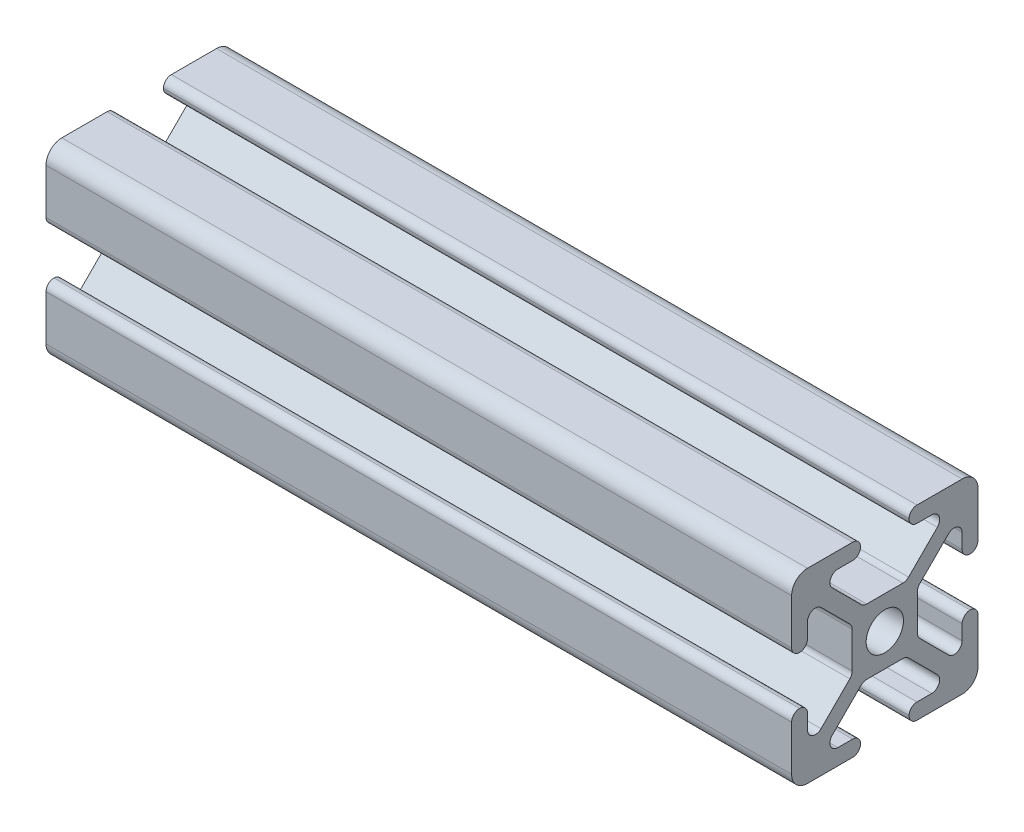
from build123d import *

# Parameters (mm, degrees)
SKETCH1_R           = 2.5
BOSS_EXTRUDE1_DEPTH = 100
FILLET1_R           = 1.065
FILLET2_R           = 2.13


with BuildPart() as part:
    # Sketch1 → Boss-Extrude1 (new body)
    with BuildSketch(Plane.YZ):
        Polygon((-12.5, -3.25), (-12.5, -12.5), (-3.25, -12.5), (-3.25, -10.37), (-8.863862556, -10.37), (-2.873862556, -4.38), (2.873862556, -4.38), (8.863862556, -10.37), (3.25, -10.37), (3.25, -12.5), (12.5, -12.5), (12.5, -3.25), (10.37, -3.25), (10.37, -8.863862556), (4.38, -2.873862556), (4.38, 2.873862556), (10.37, 8.863862556), (10.37, 3.25), (12.5, 3.25), (12.5, 12.5), (3.25, 12.5), (3.25, 10.37), (8.863862556, 10.37), (2.873862556, 4.38), (-2.873862556, 4.38), (-8.863862556, 10.37), (-3.25, 10.37), (-3.25, 12.5), (-12.5, 12.5), (-12.5, 3.25), (-10.37, 3.25), (-10.37, 8.863862556), (-4.38, 2.873862556), (-4.38, -2.873862556), (-10.37, -8.863862556), (-10.37, -3.25), align=None)
        with Locations(Location((0, 0, 0), (0, 0, 270))):
            Circle(SKETCH1_R, mode=Mode.SUBTRACT)
    extrude(amount=BOSS_EXTRUDE1_DEPTH)

    # Fillet1
    fillet1_edges = [part.edges().sort_by_distance(p)[0] for p in [
        (50, -10.37, -8.863862556),
        (50, 2.873862556, -4.38),
        (50, -2.873862556, -4.38),
        (50, -4.38, 2.873862556),
        (50, -4.38, -2.873862556),
        (50, -2.873862556, 4.38),
        (50, 2.873862556, 4.38),
        (50, 4.38, 2.873862556),
        (50, 4.38, -2.873862556),
        (50, -8.863862556, -10.37),
        (50, 8.863862556, -10.37),
        (50, 10.37, -8.863862556),
        (50, -10.37, 8.863862556),
        (50, -8.863862556, 10.37),
        (50, 10.37, 8.863862556),
        (50, 8.863862556, 10.37),
        (50, 12.5, 3.25),
        (50, -3.25, -12.5),
        (50, -10.37, 3.25),
        (50, 10.37, 3.25),
        (50, -10.37, -3.25),
        (50, -12.5, -3.25),
        (50, -12.5, 3.25),
        (50, 3.25, -10.37),
        (50, -3.25, -10.37),
        (50, 3.25, -12.5),
        (50, 10.37, -3.25),
        (50, 12.5, -3.25),
        (50, 3.25, 12.5),
        (50, 3.25, 10.37),
        (50, -3.25, 10.37),
        (50, -3.25, 12.5),
    ]]
    fillet(fillet1_edges, radius=FILLET1_R - 0.0001)  # a hair under: the kernel refuses the full size

    # Fillet2
    fillet2_edges = [part.edges().sort_by_distance(p)[0] for p in [
        (50, -12.5, 12.5),
        (50, 12.5, 12.5),
        (50, 12.5, -12.5),
        (50, -12.5, -12.5),
    ]]
    fillet(fillet2_edges, radius=FILLET2_R)


solid = part.part
